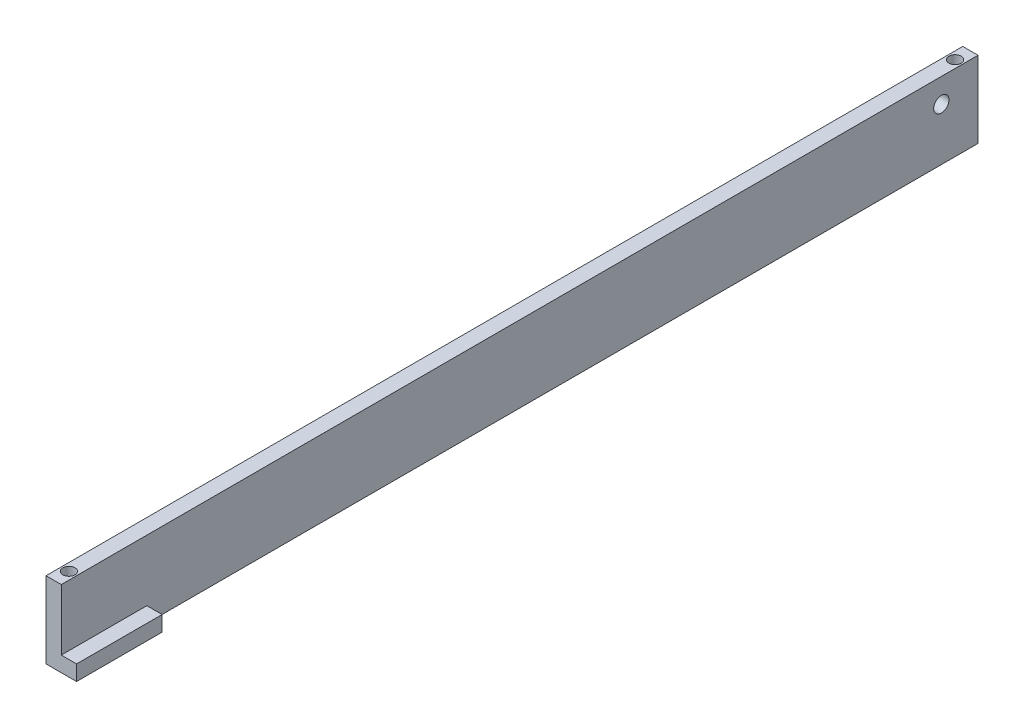
from build123d import *

# Parameters (mm, degrees)
BOSS_EXTRUDE1_DEPTH = 381
CUT_EXTRUDE1_REACH  = 384.532
SKETCH2_R           = 3.175
SKETCH3_R           = 2.54
CUT_EXTRUDE2_DEPTH  = 7.62
CUT_EXTRUDE3_START  = -7.62
SKETCH4_R           = 2.54
CUT_EXTRUDE3_DEPTH  = 7.62
SKETCH5_W           = 6.35
SKETCH5_H           = 6.35
CUT_EXTRUDE4_DEPTH  = 345.44


with BuildPart() as part:
    # Sketch1 → Boss-Extrude1 (new body)
    with BuildSketch(Plane.XY):
        Polygon((0, 0), (-12.7, 0), (-12.7, 31.75), (-6.35, 31.75), (-6.35, 6.35), (0, 6.35), align=None)
    extrude(amount=-BOSS_EXTRUDE1_DEPTH)

    # Sketch2 → Cut-Extrude1 (cut, up to next)
    with BuildSketch(Plane.ZY.offset(12.7), mode=Mode.PRIVATE) as cut_extrude1_sk1:
        with Locations((-365.76, 21.749999934)):
            Circle(SKETCH2_R)
    cut_extrude1_tool1 = extrude(cut_extrude1_sk1.sketch, amount=-CUT_EXTRUDE1_REACH, mode=Mode.PRIVATE) & part.part
    add(cut_extrude1_tool1.solids().sort_by_distance((-12.7, 21.75, -365.76))[0], mode=Mode.SUBTRACT)

    # Sketch3 → Cut-Extrude2 (cut)
    with BuildSketch(Plane(origin=(0, 31.75, 0), x_dir=(1, 0, 0), z_dir=(0, 1, 0))):
        with Locations((-9.525, 6.35)):
            Circle(SKETCH3_R)
        with Locations((-9.525, 374.65)):
            Circle(SKETCH3_R)
    extrude(amount=-CUT_EXTRUDE2_DEPTH, mode=Mode.SUBTRACT)

    # Sketch4 → Cut-Extrude3 (cut)
    with BuildSketch(Plane.XZ.offset(CUT_EXTRUDE3_START)):
        with Locations((-9.525, -374.65)):
            Circle(SKETCH4_R)
        with Locations((-9.525, -6.35)):
            Circle(SKETCH4_R)
    extrude(amount=CUT_EXTRUDE3_DEPTH, mode=Mode.SUBTRACT)

    # Sketch5 → Cut-Extrude4 (cut)
    with BuildSketch(Plane(origin=(0, 0, -381), x_dir=(-1, 0, 0), z_dir=(0, 0, -1))):
        with Locations((3.175, 3.175)):
            Rectangle(SKETCH5_W, SKETCH5_H)
    extrude(amount=-CUT_EXTRUDE4_DEPTH, mode=Mode.SUBTRACT)


solid = part.part
